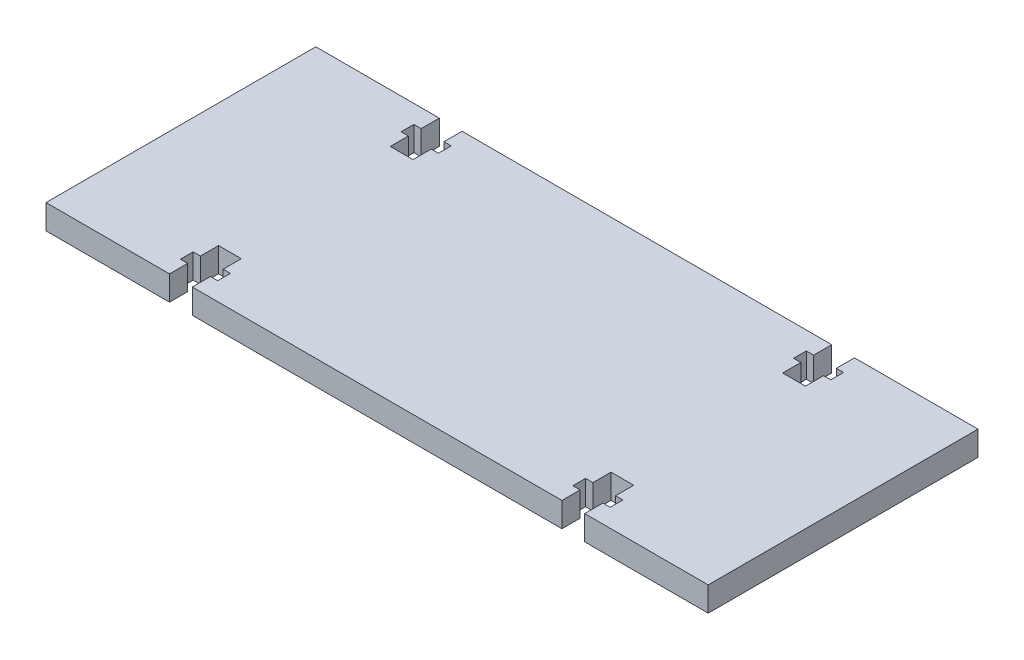
from build123d import *

# Parameters (mm, degrees)
SKETCH1_W           = 85.725
SKETCH1_H           = 34.925
BOSS_EXTRUDE1_DEPTH = 3.175
CUT_EXTRUDE2_DEPTH  = 47.391954448


with BuildPart() as part:
    # Sketch1 → Boss-Extrude1 (new body)
    with BuildSketch(Plane(origin=(0, 0, 0), x_dir=(1, 0, 0), z_dir=(0, 1, 0))):
        Rectangle(SKETCH1_W, SKETCH1_H)
    extrude(amount=BOSS_EXTRUDE1_DEPTH)

    # Sketch3 → Cut-Extrude2 (cut, through all)
    with BuildSketch(Plane.XZ):
        Polygon((-26.8732, 17.4625), (-23.9268, 17.4625), (-23.9268, 15.113), (-22.987, 15.113), (-22.987, 13.462), (-23.9268, 13.462), (-23.9268, 11.1125), (-26.8732, 11.1125), (-26.8732, 13.462), (-27.813, 13.462), (-27.813, 15.113), (-26.8732, 15.113), align=None)
        Polygon((26.8732, 13.462), (26.8732, 11.1125), (23.9268, 11.1125), (23.9268, 13.462), (22.987, 13.462), (22.987, 15.113), (23.9268, 15.113), (23.9268, 17.4625), (26.8732, 17.4625), (26.8732, 15.113), (27.813, 15.113), (27.813, 13.462), align=None)
        Polygon((26.8732, -17.4625), (23.9268, -17.4625), (23.9268, -15.113), (22.987, -15.113), (22.987, -13.462), (23.9268, -13.462), (23.9268, -11.1125), (26.8732, -11.1125), (26.8732, -13.462), (27.813, -13.462), (27.813, -15.113), (26.8732, -15.113), align=None)
        Polygon((-26.8732, -13.462), (-26.8732, -11.1125), (-23.9268, -11.1125), (-23.9268, -13.462), (-22.987, -13.462), (-22.987, -15.113), (-23.9268, -15.113), (-23.9268, -17.4625), (-26.8732, -17.4625), (-26.8732, -15.113), (-27.813, -15.113), (-27.813, -13.462), align=None)
    extrude(amount=-CUT_EXTRUDE2_DEPTH, mode=Mode.SUBTRACT)


solid = part.part
